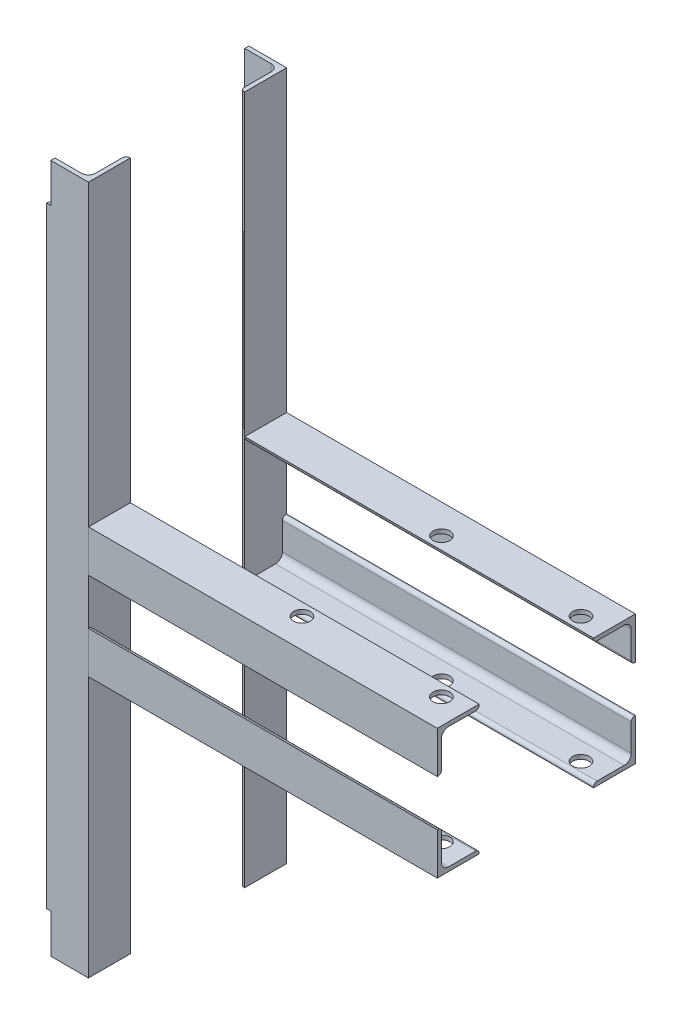
from build123d import *

# Parameters (mm, degrees)
STRUCTURE_SYSTEM1_DEPTH   = 494
STRUCTURE_SYSTEM1_2_DEPTH = 250
CUT_EXTRUDE1_DEPTH        = 572.576766498
CUT_EXTRUDE1_DEPTH_BACK   = 572.576766498
SKETCH2_W                 = 3
SKETCH2_H                 = 28
SKETCH3_R                 = 6
CUT_EXTRUDE2_DEPTH        = 383.022250661


# Read off the part's stored shape, not the designer's step: Structure System1
with BuildPart() as part:
    # Structure System1 outline → Structure System1 (new body)
    with BuildSketch(Plane(origin=(0, 0, 0), x_dir=(1, 0, 0), z_dir=(0, 1, 0))):
        with BuildLine():
            Line((0, 41), (0, 71))
            Line((0, 71), (-30, 71))
            Line((-30, 71), (-30, 70.5))
            ThreePointArc((-30, 70.5), (-29.267766953, 68.732233047), (-27.5, 68))
            Line((-27.5, 68), (-8, 68))
            ThreePointArc((-8, 68), (-4.464466094, 66.535533906), (-3, 63))
            Line((-3, 63), (-3, 43.5))
            ThreePointArc((-3, 43.5), (-2.267766953, 41.732233047), (-0.5, 41))
            Line((-0.5, 41), (0, 41))
        make_face()
        with BuildLine():
            Line((-30, -71), (0, -71))
            Line((0, -71), (0, -41))
            Line((0, -41), (-0.5, -41))
            ThreePointArc((-0.5, -41), (-2.267766953, -41.732233047), (-3, -43.5))
            Line((-3, -43.5), (-3, -63))
            ThreePointArc((-3, -63), (-4.464466094, -66.535533906), (-8, -68))
            Line((-8, -68), (-27.5, -68))
            ThreePointArc((-27.5, -68), (-29.267766953, -68.732233047), (-30, -70.5))
            Line((-30, -70.5), (-30, -71))
        make_face()
    extrude(amount=STRUCTURE_SYSTEM1_DEPTH)

    # Sketch2 → Cut-Extrude1 (cut, two sides: drawn at the far end of the back side and taken through both)
    with BuildSketch(Plane.XY.offset(71).offset(-CUT_EXTRUDE1_DEPTH_BACK)):
        with Locations((-28.5, 14)):
            Rectangle(SKETCH2_W, SKETCH2_H)
        with Locations((-28.5, 480)):
            Rectangle(SKETCH2_W, SKETCH2_H)
    extrude(amount=CUT_EXTRUDE1_DEPTH + CUT_EXTRUDE1_DEPTH_BACK, mode=Mode.SUBTRACT)


with BuildPart() as body_2:
    # Structure System1 2 outline → Structure System1 2 (new body)
    with BuildSketch(Plane.YZ):
        with BuildLine():
            Line((187, -41), (187, -71))
            Line((187, -71), (217, -71))
            Line((217, -71), (217, -70.5))
            ThreePointArc((217, -70.5), (216.267766953, -68.732233047), (214.5, -68))
            Line((214.5, -68), (195, -68))
            ThreePointArc((195, -68), (191.464466094, -66.535533906), (190, -63))
            Line((190, -63), (190, -43.5))
            ThreePointArc((190, -43.5), (189.267766953, -41.732233047), (187.5, -41))
            Line((187.5, -41), (187, -41))
        make_face()
        with BuildLine():
            Line((250, -71), (280, -71))
            Line((280, -71), (280, -41))
            Line((280, -41), (279.5, -41))
            ThreePointArc((279.5, -41), (277.732233047, -41.732233047), (277, -43.5))
            Line((277, -43.5), (277, -63))
            ThreePointArc((277, -63), (275.535533906, -66.535533906), (272, -68))
            Line((272, -68), (252.5, -68))
            ThreePointArc((252.5, -68), (250.732233047, -68.732233047), (250, -70.5))
            Line((250, -70.5), (250, -71))
        make_face()
        with BuildLine():
            Line((280, 41), (280, 71))
            Line((280, 71), (250, 71))
            Line((250, 71), (250, 70.5))
            ThreePointArc((250, 70.5), (250.732233047, 68.732233047), (252.5, 68))
            Line((252.5, 68), (272, 68))
            ThreePointArc((272, 68), (275.535533906, 66.535533906), (277, 63))
            Line((277, 63), (277, 43.5))
            ThreePointArc((277, 43.5), (277.732233047, 41.732233047), (279.5, 41))
            Line((279.5, 41), (280, 41))
        make_face()
        with BuildLine():
            Line((217, 71), (187, 71))
            Line((187, 71), (187, 41))
            Line((187, 41), (187.5, 41))
            ThreePointArc((187.5, 41), (189.267766953, 41.732233047), (190, 43.5))
            Line((190, 43.5), (190, 63))
            ThreePointArc((190, 63), (191.464466094, 66.535533906), (195, 68))
            Line((195, 68), (214.5, 68))
            ThreePointArc((214.5, 68), (216.267766953, 68.732233047), (217, 70.5))
            Line((217, 70.5), (217, 71))
        make_face()
    extrude(amount=STRUCTURE_SYSTEM1_2_DEPTH)

    # Sketch3 → Cut-Extrude2 (cut, through all)
    with BuildSketch(Plane(origin=(0, 280, 0), x_dir=(1, 0, 0), z_dir=(0, 1, 0))):
        with Locations(Location((232, 50, 0), (0, 0, 270))):
            Circle(SKETCH3_R)
        with Locations(Location((232, -50, 0), (0, 0, 270))):
            Circle(SKETCH3_R)
        with Locations(Location((132, -50, 0), (0, 0, 270))):
            Circle(SKETCH3_R)
        with Locations(Location((132, 50, 0), (0, 0, 270))):
            Circle(SKETCH3_R)
    extrude(amount=-CUT_EXTRUDE2_DEPTH, mode=Mode.SUBTRACT)


solid = Compound([part.part, body_2.part])
